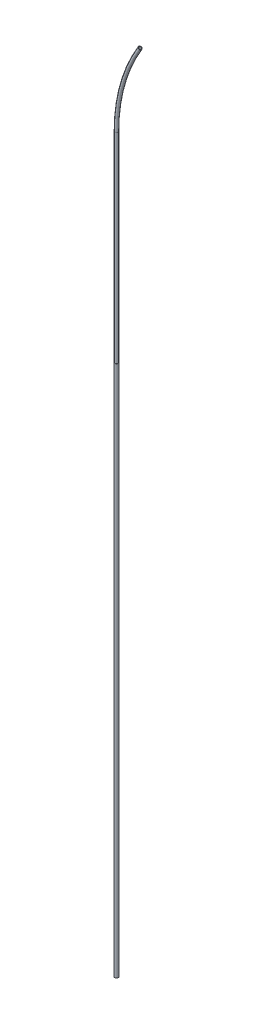
from build123d import *

# Parameters (mm, degrees)
SKETCH1_R           = 1.016
SKETCH1_R_2         = 0.73
BOSS_EXTRUDE1_DEPTH = 135
SWEEP2_OUTLINE_R    = 1.016
SWEEP2_OUTLINE_R_2  = 0.73
SWEEP2_ANGLE        = 31.512679
SKETCH4_R           = 1.2065
SKETCH4_R_2         = 1.0795
BOSS_EXTRUDE2_DEPTH = 332


# Read off the part's stored shape, not the designer's step: Sweep2
with BuildPart() as part:
    # Sketch1 → Boss-Extrude1 (new body)
    with BuildSketch(Plane(origin=(0, 0, 0), x_dir=(1, 0, 0), z_dir=(0, 1, 0))):
        with Locations(Location((0, 0, 0), (0, 0, 270))):
            Circle(SKETCH1_R)
        with Locations(Location((0, 0, 0), (0, 0, 270))):
            Circle(SKETCH1_R_2, mode=Mode.SUBTRACT)
    extrude(amount=BOSS_EXTRUDE1_DEPTH)

    # Sweep2 outline → Sweep2 (revolve)
    with BuildSketch(Plane(origin=(100, 135, 0), x_dir=(-0.8525245220595056, 0.5226872289306596, 0), z_dir=(0.5226872289306596, 0.8525245220595056, 0))):
        with Locations((100, 0)):
            Circle(SWEEP2_OUTLINE_R)
        with Locations((100, 0)):
            Circle(SWEEP2_OUTLINE_R_2, mode=Mode.SUBTRACT)
    revolve(axis=Axis((100, 135, 0), (0, 0, 1)), revolution_arc=SWEEP2_ANGLE)


with BuildPart() as body_2:
    # Sketch4 → Boss-Extrude2 (new body)
    with BuildSketch(Plane(origin=(0, 10, 0), x_dir=(-1, 0, 0), z_dir=(0, -1, 0))):
        with Locations(Location((0, 0, 0), (0, 0, 90))):
            Circle(SKETCH4_R)
        with Locations(Location((0, 0, 0), (0, 0, 90))):
            Circle(SKETCH4_R_2, mode=Mode.SUBTRACT)
    extrude(amount=BOSS_EXTRUDE2_DEPTH)


solid = Compound([part.part, body_2.part])
